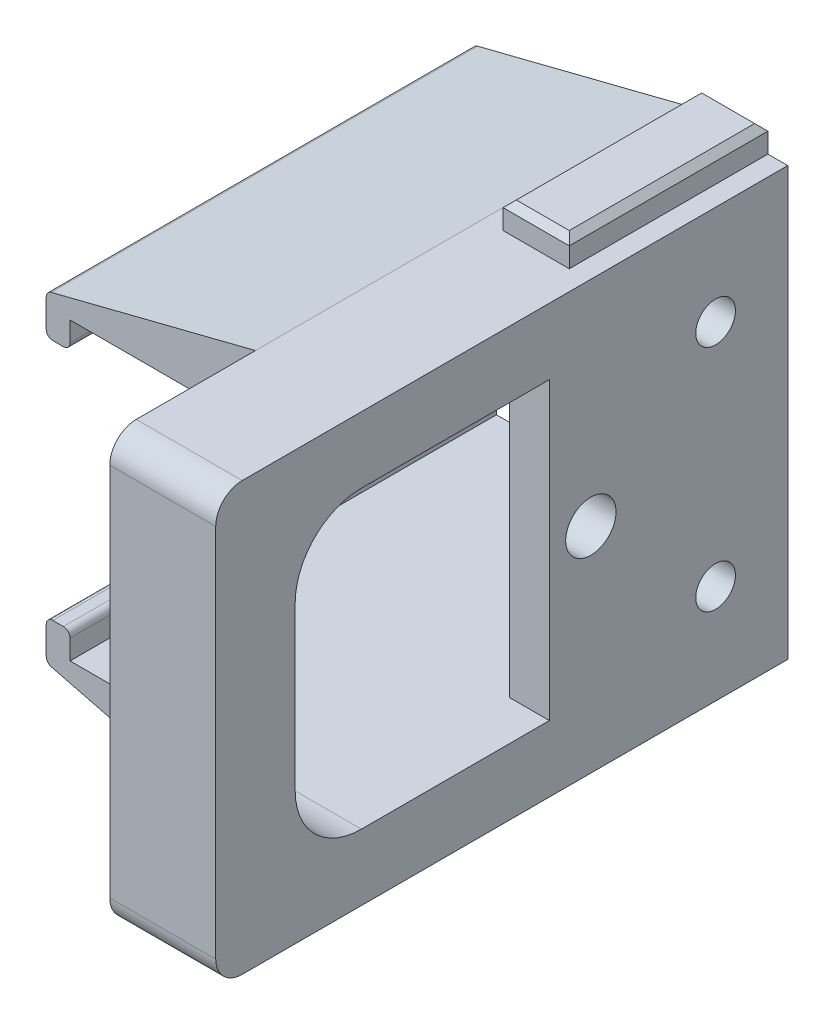
from build123d import *

# Parameters (mm, degrees)
BOSS_EXTRUDE1_DEPTH         = 3
BOSS_EXTRUDE1_DEPTH_BACK    = 5
SKETCH2_W                   = 18
SKETCH2_H                   = 32.3
SKETCH2_R                   = 1.9
BOSS_EXTRUDE2_DEPTH         = 3
CUT_EXTRUDE1_REACH          = 53.726
AGUJEROSMOTOR_R             = 1.5
SKETCH5_W                   = 32.2
SKETCH5_H                   = 5
BOSS_EXTRUDE3_DEPTH         = 15.8
CHAFL_N1_SIZE               = 15.8
CHAFL_N1_SIZE2              = 4
CROQUIS1_W                  = 1.8
CROQUIS1_H                  = 32.2
SALIENTE_EXTRUIR1_DEPTH     = 2
REDONDEO2_R                 = 0.5
CROQUIS3_W                  = 5
CROQUIS3_H                  = 15
SALIENTE_EXTRUIR2_DEPTH     = 2
CHAFL_N2_SIZE               = 0.5
CHAFL_N3_SIZE               = 4
CHAFL_N3_SIZE2              = 15.8
CHAFL_N2_OF_SIMETR_A15_SIZE = 0.5
REDONDEO3_R                 = 0.5


with BuildPart() as part:
    # U → Boss-Extrude1 (new, two sides: drawn at the far end of the back side and taken through both)
    with BuildSketch(Plane(origin=(0, 0, 0), x_dir=(0, 0, -1), z_dir=(1, 0, 0)).offset(-BOSS_EXTRUDE1_DEPTH_BACK)):
        with BuildLine():
            Line((0, 22.3), (0, 27.3))
            Line((0, 27.3), (-41.2, 27.3))
            ThreePointArc((-41.2, 27.3), (-42.614213562, 26.714213562), (-43.2, 25.3))
            Line((-43.2, 25.3), (-43.2, -3))
            ThreePointArc((-43.2, -3), (-42.614213562, -4.414213562), (-41.2, -5))
            Line((-41.2, -5), (0, -5))
            Line((0, -5), (0, 0))
            Line((0, 0), (-32.2, 0))
            ThreePointArc((-32.2, 0), (-35.735533906, 1.464466094), (-37.2, 5))
            Line((-37.2, 5), (-37.2, 17.3))
            ThreePointArc((-37.2, 17.3), (-35.735533906, 20.835533906), (-32.2, 22.3))
            Line((-32.2, 22.3), (0, 22.3))
        make_face()
    extrude(amount=BOSS_EXTRUDE1_DEPTH + BOSS_EXTRUDE1_DEPTH_BACK)

    # Sketch2 → Boss-Extrude2 (add)
    with BuildSketch(Plane(origin=(0, 0, 0), x_dir=(0, 0, -1), z_dir=(1, 0, 0))):
        with Locations((-9, 11.15)):
            Rectangle(SKETCH2_W, SKETCH2_H)
        with Locations((-14.87, 11.15)):
            Circle(SKETCH2_R, mode=Mode.SUBTRACT)
    extrude(amount=BOSS_EXTRUDE2_DEPTH)

    # AgujerosMotor → Cut-Extrude1 (cut, up to next)
    with BuildSketch(Plane(origin=(3, 0, 0), x_dir=(0, 0, -1), z_dir=(1, 0, 0)), mode=Mode.PRIVATE) as cut_extrude1_sk1:
        with Locations((-5.45, 2.5)):
            Circle(AGUJEROSMOTOR_R)
    cut_extrude1_tool1 = extrude(cut_extrude1_sk1.sketch, amount=-CUT_EXTRUDE1_REACH, mode=Mode.PRIVATE) & part.part
    # AgujerosMotor → Cut-Extrude1 (cut, up to next)
    with BuildSketch(Plane(origin=(3, 0, 0), x_dir=(0, 0, -1), z_dir=(1, 0, 0)), mode=Mode.PRIVATE) as cut_extrude1_sk2:
        with Locations((-5.45, 19.8)):
            Circle(AGUJEROSMOTOR_R)
    cut_extrude1_tool2 = extrude(cut_extrude1_sk2.sketch, amount=-CUT_EXTRUDE1_REACH, mode=Mode.PRIVATE) & part.part
    add(cut_extrude1_tool1.solids().sort_by_distance((3, 2.5, 5.45))[0], mode=Mode.SUBTRACT)
    add(cut_extrude1_tool2.solids().sort_by_distance((3, 19.8, 5.45))[0], mode=Mode.SUBTRACT)

    # Sketch5 → Boss-Extrude3 (add)
    with BuildSketch(Plane.ZY.offset(5)):
        with Locations((16.1, 24.8)):
            Rectangle(SKETCH5_W, SKETCH5_H)
    boss_extrude3 = extrude(amount=BOSS_EXTRUDE3_DEPTH)

    # Chaflán1
    chafl_n1_edges = [part.edges().sort_by_distance(p)[0] for p in [
        (-20.8, 27.3, 16.1),
    ]]
    chafl_n1_side = [part.faces().sort_by_distance(p)[0] for p in [
        (-8.221532516, 27.3, 17.869168376),
    ]]
    chamfer(chafl_n1_edges, length=CHAFL_N1_SIZE, length2=CHAFL_N1_SIZE2, reference=chafl_n1_side[0])

    # Croquis1 → Saliente-Extruir1 (add)
    with BuildSketch(Plane.XZ.offset(-22.3)):
        with Locations((-19.9, 16.1)):
            Rectangle(CROQUIS1_W, CROQUIS1_H)
    saliente_extruir1 = extrude(amount=SALIENTE_EXTRUIR1_DEPTH)

    # Redondeo2
    redondeo2_edges = [part.edges().sort_by_distance(p)[0] for p in [
        (-20.8, 23.3, 16.1),
        (-20.8, 20.3, 16.1),
        (-19, 20.3, 16.1),
    ]]
    fillet(redondeo2_edges, radius=REDONDEO2_R)

    # Croquis3 → Saliente-Extruir2 (add)
    with BuildSketch(Plane(origin=(0, 27.3, 0), x_dir=(1, 0, 0), z_dir=(0, 1, 0))):
        with Locations((-1, -7.5)):
            Rectangle(CROQUIS3_W, CROQUIS3_H)
    saliente_extruir2 = extrude(amount=SALIENTE_EXTRUIR2_DEPTH)

    # Chaflán2
    chafl_n2_edges = [part.edges().sort_by_distance(p)[0] for p in [
        (-1, 29.3, 0),
        (-3.5, 29.3, 7.5),
        (-1, 29.3, 15),
        (1.5, 29.3, 7.5),
    ]]
    chamfer(chafl_n2_edges, length=CHAFL_N2_SIZE)

    # Simetría11: Boss-Extrude3 across plane
    add(boss_extrude3.mirror(Plane.ZX.offset(11.15)))

    # Chaflán3
    chafl_n3_edges = [part.edges().sort_by_distance(p)[0] for p in [
        (-20.8, -5, 16.1),
    ]]
    chafl_n3_side = [part.faces().sort_by_distance(p)[0] for p in [
        (-20.8, -2.5, 16.1),
    ]]
    chamfer(chafl_n3_edges, length=CHAFL_N3_SIZE, length2=CHAFL_N3_SIZE2, reference=chafl_n3_side[0])

    # Simetría14: Saliente-Extruir1 across plane
    add(saliente_extruir1.mirror(Plane.ZX.offset(11.15)))

    # Simetría15: Saliente-Extruir2 across plane
    add(saliente_extruir2.mirror(Plane.ZX.offset(11.15)))

    # Chaflán2 of Simetría15
    chafl_n2_of_simetr_a15_edges = [part.edges().sort_by_distance(p)[0] for p in [
        (-1, -7, 0),
        (-3.5, -7, 7.5),
        (-1, -7, 15),
        (1.5, -7, 7.5),
    ]]
    chamfer(chafl_n2_of_simetr_a15_edges, length=CHAFL_N2_OF_SIMETR_A15_SIZE)

    # Redondeo3
    redondeo3_edges = [part.edges().sort_by_distance(p)[0] for p in [
        (-20.8, -1, 16.1),
        (-19, 2, 16.1),
        (-20.8, 2, 16.1),
    ]]
    fillet(redondeo3_edges, radius=REDONDEO3_R)


solid = part.part
